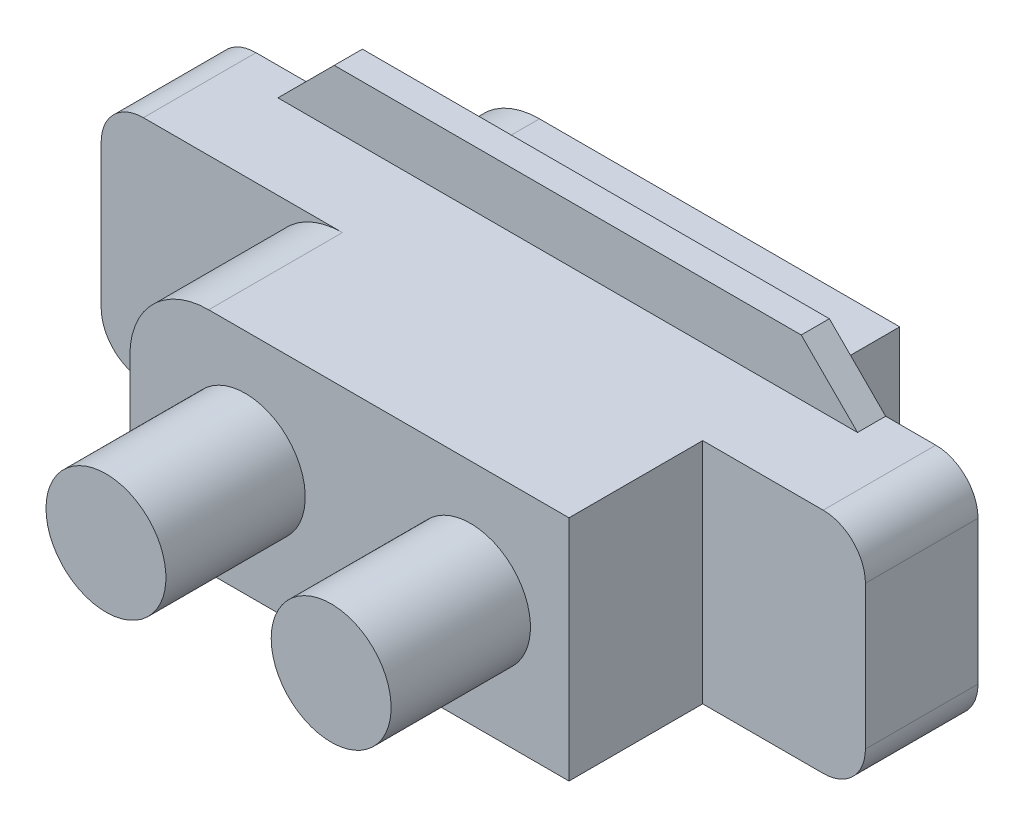
from build123d import *

# Parameters (mm, degrees)
DODANIE_WYCI_GNI_CIE1_DEPTH = 3
DODANIE_WYCI_GNI_CIE2_DEPTH = 1
SFAZOWANIE1_SIZE            = 2
DODANIE_WYCI_GNI_CIE3_DEPTH = 3
DODANIE_WYCI_GNI_CIE4_START = 7
DODANIE_WYCI_GNI_CIE4_DEPTH = 4.75
SZKIC6_R                    = 2.13
DODANIE_WYCI_GNI_CIE5_DEPTH = 4.95


with BuildPart() as part:
    # Szkic1 → Dodanie-wyciągnięcie1 (new body)
    with BuildSketch(Plane.XY):
        with BuildLine():
            Line((2.8, 0), (15.6, 0))
            Line((15.6, 0), (15.6, 8.1))
            Line((15.6, 8.1), (2.8, 8.1))
            ThreePointArc((2.8, 8.1), (0.820101013, 7.279898987), (0, 5.3))
            Line((0, 5.3), (0, 2.8))
            ThreePointArc((0, 2.8), (0.820101013, 0.820101013), (2.8, 0))
        make_face()
    extrude(amount=DODANIE_WYCI_GNI_CIE1_DEPTH)

    # Szkic2 → Dodanie-wyciągnięcie2 (add)
    with BuildSketch(Plane.XY.offset(3)):
        with BuildLine():
            Line((-0.49, 10.1), (16.1, 10.1))
            Line((16.1, 10.1), (16.1, 8.1))
            Line((16.1, 8.1), (19.88, 8.1))
            ThreePointArc((19.88, 8.1), (20.940660172, 7.660660172), (21.38, 6.6))
            Line((21.38, 6.6), (21.38, 1.5))
            ThreePointArc((21.38, 1.5), (20.940660172, 0.439339828), (19.88, 0))
            Line((19.88, 0), (16.1, 0))
            Line((16.1, 0), (16.1, -2))
            Line((16.1, -2), (-0.49, -2))
            Line((-0.49, -2), (-0.49, 0))
            Line((-0.49, 0), (-4.27, 0))
            ThreePointArc((-4.27, 0), (-5.330660172, 0.439339828), (-5.77, 1.5))
            Line((-5.77, 1.5), (-5.77, 6.6))
            ThreePointArc((-5.77, 6.6), (-5.330660172, 7.660660172), (-4.27, 8.1))
            Line((-4.27, 8.1), (-0.49, 8.1))
            Line((-0.49, 8.1), (-0.49, 10.1))
        make_face()
    extrude(amount=DODANIE_WYCI_GNI_CIE2_DEPTH)

    # Sfazowanie1
    sfazowanie1_edges = [part.edges().sort_by_distance(p)[0] for p in [
        (16.1, 8.1, 3.5),
        (16.1, 0, 3.5),
        (-0.49, 0, 3.5),
        (-0.49, 8.1, 3.5),
    ]]
    chamfer(sfazowanie1_edges, length=SFAZOWANIE1_SIZE - 0.0001)  # a hair under: the kernel refuses the full size

    # Szkic4 → Dodanie-wyciągnięcie3 (add)
    with BuildSketch(Plane.XY.offset(4)):
        with BuildLine():
            Line((19.88, 8.1), (18.1, 8.1))
            Line((18.1, 8.1), (-2.49, 8.1))
            Line((-2.49, 8.1), (-4.27, 8.1))
            ThreePointArc((-4.27, 8.1), (-5.330660172, 7.660660172), (-5.77, 6.6))
            Line((-5.77, 6.6), (-5.77, 1.5))
            ThreePointArc((-5.77, 1.5), (-5.330660172, 0.439339828), (-4.27, 0))
            Line((-4.27, 0), (-2.49, 0))
            Line((-2.49, 0), (18.1, 0))
            Line((18.1, 0), (19.88, 0))
            ThreePointArc((19.88, 0), (20.940660172, 0.439339828), (21.38, 1.5))
            Line((21.38, 1.5), (21.38, 6.6))
            ThreePointArc((21.38, 6.6), (20.940660172, 7.660660172), (19.88, 8.1))
        make_face()
    extrude(amount=DODANIE_WYCI_GNI_CIE3_DEPTH)

    # Szkic1<2> → Dodanie-wyciągnięcie4 (add)
    with BuildSketch(Plane.XY.offset(DODANIE_WYCI_GNI_CIE4_START)):
        with BuildLine():
            Line((2.8, 0), (15.6, 0))
            Line((15.6, 0), (15.6, 8.1))
            Line((15.6, 8.1), (2.8, 8.1))
            ThreePointArc((2.8, 8.1), (0.820101013, 7.279898987), (0, 5.3))
            Line((0, 5.3), (0, 2.8))
            ThreePointArc((0, 2.8), (0.820101013, 0.820101013), (2.8, 0))
        make_face()
    extrude(amount=DODANIE_WYCI_GNI_CIE4_DEPTH)

    # Szkic6 → Dodanie-wyciągnięcie5 (add)
    with BuildSketch(Plane.XY.offset(11.75)):
        with Locations(Location((4.1, 4.05, 0), (0, 0, 180))):
            Circle(SZKIC6_R)
        with Locations(Location((12.1, 4.05, 0), (0, 0, 180))):
            Circle(SZKIC6_R)
    extrude(amount=DODANIE_WYCI_GNI_CIE5_DEPTH)


solid = part.part
